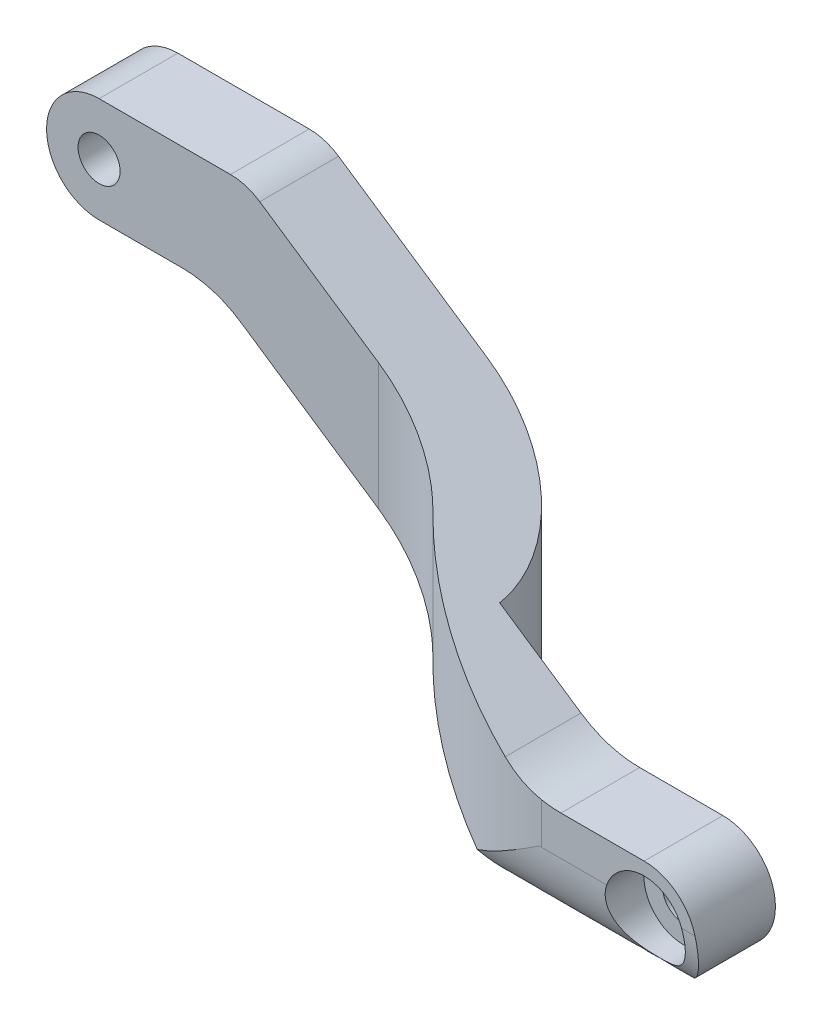
from build123d import *

# Parameters (mm, degrees)
BOSS_EXTRUDE1_DEPTH      = 3
BOSS_EXTRUDE1_DEPTH_BACK = 4.5
SKETCH1_R                = 0.8
FILLET1_R                = 4
CUT_EXTRUDE2_DEPTH       = 29.619267985
CUT_EXTRUDE2_DEPTH_BACK  = 29.619267985
SKETCH4_W                = 10.5
SKETCH4_H                = 4.5
CUT_EXTRUDE3_DEPTH       = 29.619267985
CUT_EXTRUDE3_DEPTH_BACK  = 29.619267985
SKETCH5_W                = 15
SKETCH5_H                = 4.5
FILLET2_R                = 10
FILLET3_R                = 5
FILLET4_R                = 5
CUT_EXTRUDE4_START       = -6.772335917
CUT_EXTRUDE4_DEPTH       = 8.772335917
SKETCH7_R                = 1.51
CUT_EXTRUDE5_DEPTH       = 1.5


# Read off the part's stored shape, not the designer's step: Cut-Extrude4
with BuildPart() as part:
    # Sketch1 → Boss-Extrude1 (new, two sides: drawn at the far end of the back side and taken through both)
    with BuildSketch(Plane.XY.offset(-BOSS_EXTRUDE1_DEPTH_BACK)):
        with BuildLine():
            Line((-4.389678411, -3.5), (-19.133343362, 6.422379894))
            ThreePointArc((-19.133343362, 6.422379894), (-19.666253628, 6.676053774), (-20.25, 6.763139721))
            Line((-20.25, 6.763139721), (-25.25, 6.763139721))
            ThreePointArc((-25.25, 6.763139721), (-27.246991207, 4.872803379), (-25.468997361, 2.775165839))
            ThreePointArc((-25.468997361, 2.775165839), (-25.359663658, 2.766148514), (-25.25, 2.763139721))
            Line((-25.25, 2.763139721), (-20.860321589, 2.763139721))
            Line((-20.860321589, 2.763139721), (-6.116656638, -7.159240173))
            ThreePointArc((-6.116656638, -7.159240173), (-5.583746372, -7.412914053), (-5, -7.5))
            Line((-5, -7.5), (0, -7.5))
            ThreePointArc((0, -7.5), (1.974370247, -5.81915847), (0.630136986, -3.601862129))
            ThreePointArc((0.630136986, -3.601862129), (0.31915847, -3.525629753), (0, -3.5))
            Line((0, -3.5), (-4.389678411, -3.5))
        make_face()
        with Locations((0, -5.5)):
            Circle(SKETCH1_R, mode=Mode.SUBTRACT)
        with Locations((-25.25, 4.763139721)):
            Circle(SKETCH1_R, mode=Mode.SUBTRACT)
    extrude(amount=BOSS_EXTRUDE1_DEPTH + BOSS_EXTRUDE1_DEPTH_BACK)

    # Fillet1
    fillet1_edges = [part.edges().sort_by_distance(p)[0] for p in [
        (-4.389678411, -3.5, -0.75),
        (-20.860321589, 2.763139721, -0.75),
    ]]
    fillet(fillet1_edges, radius=FILLET1_R)

    # Sketch4 → Cut-Extrude2 (cut, two sides: drawn at the far end of the back side and taken through both)
    with BuildSketch(Plane(origin=(0, 0, 0), x_dir=(1, 0, 0), z_dir=(0, 1, 0)).offset(-CUT_EXTRUDE2_DEPTH_BACK)):
        with Locations((-3.25, 2.25)):
            Rectangle(SKETCH4_W, SKETCH4_H)
    extrude(amount=CUT_EXTRUDE2_DEPTH + CUT_EXTRUDE2_DEPTH_BACK, mode=Mode.SUBTRACT)

    # Sketch5 → Cut-Extrude3 (cut, two sides: drawn at the far end of the back side and taken through both)
    with BuildSketch(Plane(origin=(0, 0, 0), x_dir=(1, 0, 0), z_dir=(0, 1, 0)).offset(-CUT_EXTRUDE3_DEPTH_BACK)):
        with Locations((-19.75, -0.75)):
            Rectangle(SKETCH5_W, SKETCH5_H)
    extrude(amount=CUT_EXTRUDE3_DEPTH + CUT_EXTRUDE3_DEPTH_BACK, mode=Mode.SUBTRACT)

    # Fillet2
    # the kernel refuses this fillet: 10 mm, written as the material it takes off along each edge
    with BuildSketch(Plane(origin=(-12.25, -23.910660804, 3), x_dir=(1.537930276954748e-12, 0, -1.0), z_dir=(0, 1, 0))) as fillet2_piece_1:
        with BuildLine():
            CenterArc((10, -8.351646544), FILLET2_R, 123.367012969, 56.632987031)
            Line((0, -8.351646544), (-0.2, -8.351646544))
            Line((-0.2, -8.351646544), (-0.2, 0))
            Line((-0.2, 0), (0, 0.2))
            ThreePointArc((0, 0.2), (2.25, 0.2), (4.39, 0.167032931))
            Line((4.39, 0.167032931), (4.5, 0))
        make_face()
    extrude(amount=46.579716753, mode=Mode.SUBTRACT)

    # Fillet3
    # the kernel refuses this fillet: 5 mm, written as the material it takes off along each edge
    with BuildSketch(Plane(origin=(-8.5, -17.99261029, -4.5), x_dir=(0, 0, 1), z_dir=(0, 1, 0))) as fillet3_piece_1:
        with BuildLine():
            CenterArc((5, -4.974937186), FILLET3_R, 95.739170477, 84.260829523)
            Line((0, -4.974937186), (-0.1, -4.974937186))
            Line((-0.1, -4.974937186), (-0.1, 0))
            Line((-0.1, 0), (0, 0.1))
            ThreePointArc((0, 0.1), (2.25, 0.1), (4.49, 0.099498744))
            Line((4.49, 0.099498744), (4.5, 0))
        make_face()
    extrude(amount=29.696169959, mode=Mode.SUBTRACT)

    # Fillet4
    fillet4_edges = [part.edges().sort_by_distance(p)[0] for p in [
        (-12.25, -0.620802428, -1.5),
    ]]
    fillet(fillet4_edges, radius=FILLET4_R)

    # Cut-Extrude4 outline → Cut-Extrude4 (cut)
    with BuildSketch(Plane(origin=(0, 0, 0), x_dir=(0, 0, -1), z_dir=(1, 0, 0)).offset(CUT_EXTRUDE4_START)):
        with BuildLine():
            add(Edge.make_bspline(
                [(-2.999498449, -5), (-2.961702123, -7.5), (-1.5, -7.5)],
                knots=[4.738249611, 4.738249611, 4.738249611, 6.283185307, 6.283185307, 6.283185307], degree=2, weights=[1, 0.716190529, 1]))
            Line((-2.999498449, -5), (-3, -5))
            Line((-3, -5), (-3, -7.5))
            Line((-3, -7.5), (-1.5, -7.5))
        make_face()
    extrude(amount=CUT_EXTRUDE4_DEPTH, mode=Mode.SUBTRACT)

    # Sketch7 → Cut-Extrude5 (cut)
    with BuildSketch(Plane.XY.offset(3)):
        with Locations((0, -5.5)):
            Circle(SKETCH7_R)
    extrude(amount=-CUT_EXTRUDE5_DEPTH, mode=Mode.SUBTRACT)


solid = part.part
